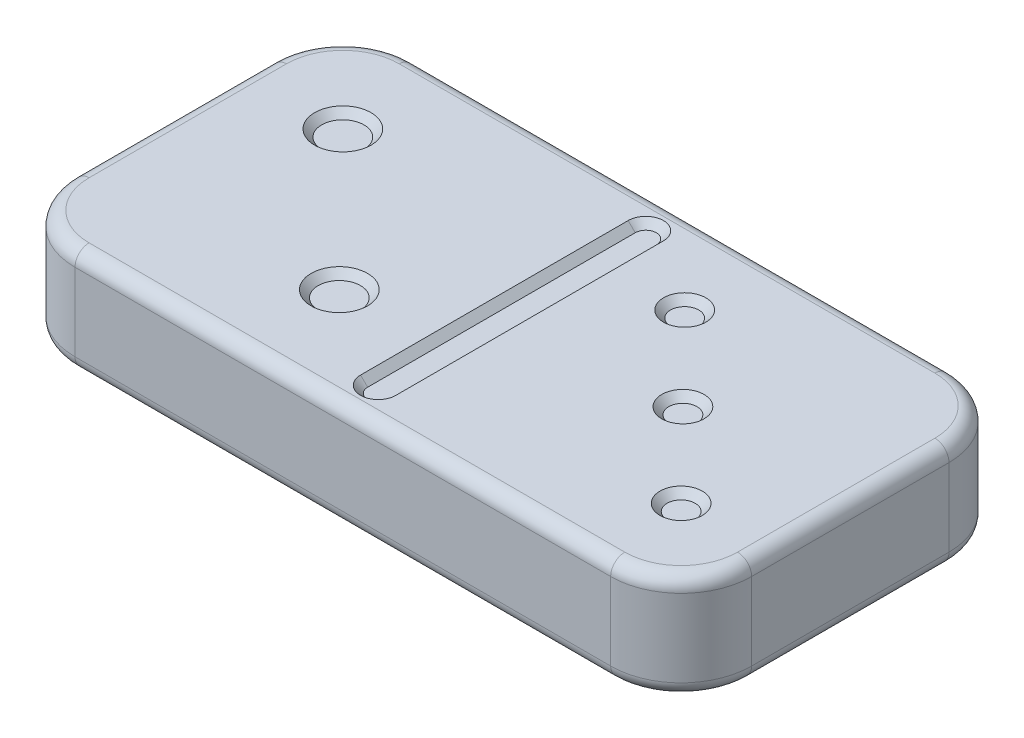
from build123d import *

# Parameters (mm, degrees)
ESQUISSE1_W                = 48
ESQUISSE1_H                = 24
EXTRUSION1_DEPTH           = 7.5
CONG_2_R                   = 5
CONG_5_R                   = 1
CONG_6_R                   = 1
ESQUISSE4_W                = 0.5
ESQUISSE4_H                = 18.982849842
EXTRUSION2_DEPTH           = 0.5
ESQUISSE5_R                = 0.25
EXTRUSION3_DEPTH           = 0.5
CHANFREIN1_SIZE            = 1
ESQUISSE9_R                = 1.5
EXTRUSION6_DEPTH           = 0.5
EXTRUSION6_DRAFT           = -45
EXTRUSION6_PROFILE_2_DEPTH = 0.5
EXTRUSION6_PROFILE_2_DRAFT = -45
EXTRUSION6_PROFILE_3_DEPTH = 0.5
EXTRUSION6_PROFILE_3_DRAFT = -45
ESQUISSE10_R               = 2
EXTRUSION7_DEPTH           = 0.5
EXTRUSION7_DRAFT           = -45
EXTRUSION7_PROFILE_2_DEPTH = 0.5
EXTRUSION7_PROFILE_2_DRAFT = -45


with BuildPart() as part:
    # Esquisse1 → Extrusion1 (new body)
    with BuildSketch(Plane(origin=(0, 0, 0), x_dir=(1, 0, 0), z_dir=(0, 1, 0))):
        with Locations((24, 12)):
            Rectangle(ESQUISSE1_W, ESQUISSE1_H)
    extrude(amount=EXTRUSION1_DEPTH)

    # Congé2
    cong_2_edges = [part.edges().sort_by_distance(p)[0] for p in [
        (0, 3.75, -24),
        (48, 3.75, -24),
        (48, 3.75, 0),
        (0, 3.75, 0),
    ]]
    fillet(cong_2_edges, radius=CONG_2_R)

    # Congé5
    cong_5_edges = [part.edges().sort_by_distance(p)[0] for p in [
        (48, 7.5, -12),
        (24, 7.5, 0),
        (0, 7.5, -12),
        (24, 7.5, -24),
        (1.464466094, 7.5, -22.535533906),
        (1.464466094, 7.5, -1.464466094),
        (46.535533906, 7.5, -22.535533906),
        (46.535533906, 7.5, -1.464466094),
    ]]
    fillet(cong_5_edges, radius=CONG_5_R)

    # Congé6
    cong_6_edges = [part.edges().sort_by_distance(p)[0] for p in [
        (48, 0, -12),
        (0, 0, -12),
        (24, 0, -24),
        (24, 0, 0),
        (1.464466094, 0, -22.535533906),
        (1.464466094, 0, -1.464466094),
        (46.535533906, 0, -22.535533906),
        (46.535533906, 0, -1.464466094),
    ]]
    fillet(cong_6_edges, radius=CONG_6_R)

    # Esquisse4 → Extrusion2 (cut)
    with BuildSketch(Plane(origin=(0, 7.5, 0), x_dir=(1, 0, 0), z_dir=(0, 1, 0))):
        with Locations((24, 12)):
            Rectangle(ESQUISSE4_W, ESQUISSE4_H)
    extrude(amount=-EXTRUSION2_DEPTH, mode=Mode.SUBTRACT)

    # Esquisse5 → Extrusion3 (cut)
    with BuildSketch(Plane(origin=(0, 7.5, 0), x_dir=(1, 0, 0), z_dir=(0, 1, 0))):
        with Locations((24, 21.491424921)):
            Circle(ESQUISSE5_R)
        with Locations((24, 2.508575079)):
            Circle(ESQUISSE5_R)
    extrude(amount=-EXTRUSION3_DEPTH, mode=Mode.SUBTRACT)

    # Chanfrein1
    # the kernel refuses this chamfer: 1 mm, written as the material it takes off along each edge
    with BuildSketch(Plane(origin=(24, 7.5, -21.491424921), x_dir=(1, 0, 0), z_dir=(0, 0, 1))) as chanfrein1_piece_1_section:
        Polygon((0.25 + CHANFREIN1_SIZE, 0), (0.25, -CHANFREIN1_SIZE), (0.25, 0), align=None)
    chanfrein1_piece_1 = revolve(axis=Axis((24, 7.5, -21.491424921), (0, 1, 0)), revolution_arc=180, mode=Mode.PRIVATE)
    chanfrein1_piece_1 = split(chanfrein1_piece_1, bisect_by=Plane(origin=(24, 7, -21.964580549), z_dir=(0, 1, 0)), keep=Keep.TOP, mode=Mode.PRIVATE)
    add(chanfrein1_piece_1, mode=Mode.SUBTRACT)
    with BuildSketch(Plane(origin=(24.25, 7.5, -21.491424921), x_dir=(0.9996219169112968, 0.02749587661058651, 0), z_dir=(0, 0, 1))) as chanfrein1_piece_2_section:
        Polygon((CHANFREIN1_SIZE * 0.999621916911, -CHANFREIN1_SIZE * 0.0274958766106), (-CHANFREIN1_SIZE * 0.0274958766106, -CHANFREIN1_SIZE * 0.999621916911), (0, 0), align=None)
    chanfrein1_piece_2 = extrude(amount=18.982849842, mode=Mode.PRIVATE)
    chanfrein1_piece_2 = split(chanfrein1_piece_2, bisect_by=Plane(origin=(24.643401084, 7, -12), z_dir=(0, 1, 0)), keep=Keep.TOP, mode=Mode.PRIVATE)
    add(chanfrein1_piece_2, mode=Mode.SUBTRACT)
    with BuildSketch(Plane(origin=(24, 7.5, -2.508575079), x_dir=(-1, 0, 0), z_dir=(0, 0, -1))) as chanfrein1_piece_3_section:
        Polygon((0.25 + CHANFREIN1_SIZE, 0), (0.25, -CHANFREIN1_SIZE), (0.25, 0), align=None)
    chanfrein1_piece_3 = revolve(axis=Axis((24, 7.5, -2.508575079), (0, 1, 0)), revolution_arc=180, mode=Mode.PRIVATE)
    chanfrein1_piece_3 = split(chanfrein1_piece_3, bisect_by=Plane(origin=(24, 7, -2.035419451), z_dir=(0, 1, 0)), keep=Keep.TOP, mode=Mode.PRIVATE)
    add(chanfrein1_piece_3, mode=Mode.SUBTRACT)
    with BuildSketch(Plane(origin=(23.75, 7.5, -2.508575079), x_dir=(-0.9996219169112968, 0.02749587661058651, 0), z_dir=(0, 0, -1))) as chanfrein1_piece_4_section:
        Polygon((CHANFREIN1_SIZE * 0.999621916911, -CHANFREIN1_SIZE * 0.0274958766106), (-CHANFREIN1_SIZE * 0.0274958766106, -CHANFREIN1_SIZE * 0.999621916911), (0, 0), align=None)
    chanfrein1_piece_4 = extrude(amount=18.982849842, mode=Mode.PRIVATE)
    chanfrein1_piece_4 = split(chanfrein1_piece_4, bisect_by=Plane(origin=(23.356598916, 7, -12), z_dir=(0, 1, 0)), keep=Keep.TOP, mode=Mode.PRIVATE)
    add(chanfrein1_piece_4, mode=Mode.SUBTRACT)


with BuildPart() as extrusion6_tool:
    # Esquisse9 → Extrusion6 (with draft: the straight prism first)
    with BuildSketch(Plane(origin=(0, 7.5, 0), x_dir=(1, 0, 0), z_dir=(0, 1, 0))):
        with Locations((30.25, 18)):
            Circle(ESQUISSE9_R)
    extrude(amount=-EXTRUSION6_DEPTH)
    # Extrusion6: the draft: its side faces are tilted about the plane it starts from
    extrusion6_sides = [extrusion6_tool.faces().sort_by_distance(p)[0] for p in [
        (28.75, 7.25, -18),
    ]]
    draft(extrusion6_sides, Plane(origin=(0, 7.5, 0), x_dir=(1, 0, 0), z_dir=(0, 1, 0)), EXTRUSION6_DRAFT)


with BuildPart() as part_1:
    add(part.part)

    # Extrusion6: cut by extrusion6_tool
    add(extrusion6_tool.part, mode=Mode.SUBTRACT)


with BuildPart() as extrusion6_profile_2_tool:
    # Esquisse9 → Extrusion6 profile 2 (with draft: the straight prism first)
    with BuildSketch(Plane(origin=(0, 7.5, 0), x_dir=(1, 0, 0), z_dir=(0, 1, 0))):
        with Locations((36.125, 12)):
            Circle(ESQUISSE9_R)
    extrude(amount=-EXTRUSION6_PROFILE_2_DEPTH)
    # Extrusion6 profile 2: the draft: its side faces are tilted about the plane it starts from
    extrusion6_profile_2_sides = [extrusion6_profile_2_tool.faces().sort_by_distance(p)[0] for p in [
        (34.625, 7.25, -12),
    ]]
    draft(extrusion6_profile_2_sides, Plane(origin=(0, 7.5, 0), x_dir=(1, 0, 0), z_dir=(0, 1, 0)), EXTRUSION6_PROFILE_2_DRAFT)


with BuildPart() as part_2:
    add(part_1.part)

    # Extrusion6 profile 2: cut by extrusion6_profile_2_tool
    add(extrusion6_profile_2_tool.part, mode=Mode.SUBTRACT)


with BuildPart() as extrusion6_profile_3_tool:
    # Esquisse9 → Extrusion6 profile 3 (with draft: the straight prism first)
    with BuildSketch(Plane(origin=(0, 7.5, 0), x_dir=(1, 0, 0), z_dir=(0, 1, 0))):
        with Locations((42, 6)):
            Circle(ESQUISSE9_R)
    extrude(amount=-EXTRUSION6_PROFILE_3_DEPTH)
    # Extrusion6 profile 3: the draft: its side faces are tilted about the plane it starts from
    extrusion6_profile_3_sides = [extrusion6_profile_3_tool.faces().sort_by_distance(p)[0] for p in [
        (40.5, 7.25, -6),
    ]]
    draft(extrusion6_profile_3_sides, Plane(origin=(0, 7.5, 0), x_dir=(1, 0, 0), z_dir=(0, 1, 0)), EXTRUSION6_PROFILE_3_DRAFT)


with BuildPart() as part_3:
    add(part_2.part)

    # Extrusion6 profile 3: cut by extrusion6_profile_3_tool
    add(extrusion6_profile_3_tool.part, mode=Mode.SUBTRACT)


with BuildPart() as extrusion7_tool:
    # Esquisse10 → Extrusion7 (with draft: the straight prism first)
    with BuildSketch(Plane(origin=(0, 7.5, 0), x_dir=(1, 0, 0), z_dir=(0, 1, 0))):
        with Locations((7, 17)):
            Circle(ESQUISSE10_R)
    extrude(amount=-EXTRUSION7_DEPTH)
    # Extrusion7: the draft: its side faces are tilted about the plane it starts from
    extrusion7_sides = [extrusion7_tool.faces().sort_by_distance(p)[0] for p in [
        (5, 7.25, -17),
    ]]
    draft(extrusion7_sides, Plane(origin=(0, 7.5, 0), x_dir=(1, 0, 0), z_dir=(0, 1, 0)), EXTRUSION7_DRAFT)


with BuildPart() as part_4:
    add(part_3.part)

    # Extrusion7: cut by extrusion7_tool
    add(extrusion7_tool.part, mode=Mode.SUBTRACT)


with BuildPart() as extrusion7_profile_2_tool:
    # Esquisse10 → Extrusion7 profile 2 (with draft: the straight prism first)
    with BuildSketch(Plane(origin=(0, 7.5, 0), x_dir=(1, 0, 0), z_dir=(0, 1, 0))):
        with Locations((16.75, 7)):
            Circle(ESQUISSE10_R)
    extrude(amount=-EXTRUSION7_PROFILE_2_DEPTH)
    # Extrusion7 profile 2: the draft: its side faces are tilted about the plane it starts from
    extrusion7_profile_2_sides = [extrusion7_profile_2_tool.faces().sort_by_distance(p)[0] for p in [
        (14.75, 7.25, -7),
    ]]
    draft(extrusion7_profile_2_sides, Plane(origin=(0, 7.5, 0), x_dir=(1, 0, 0), z_dir=(0, 1, 0)), EXTRUSION7_PROFILE_2_DRAFT)


with BuildPart() as part_5:
    add(part_4.part)

    # Extrusion7 profile 2: cut by extrusion7_profile_2_tool
    add(extrusion7_profile_2_tool.part, mode=Mode.SUBTRACT)


solid = part_5.part
